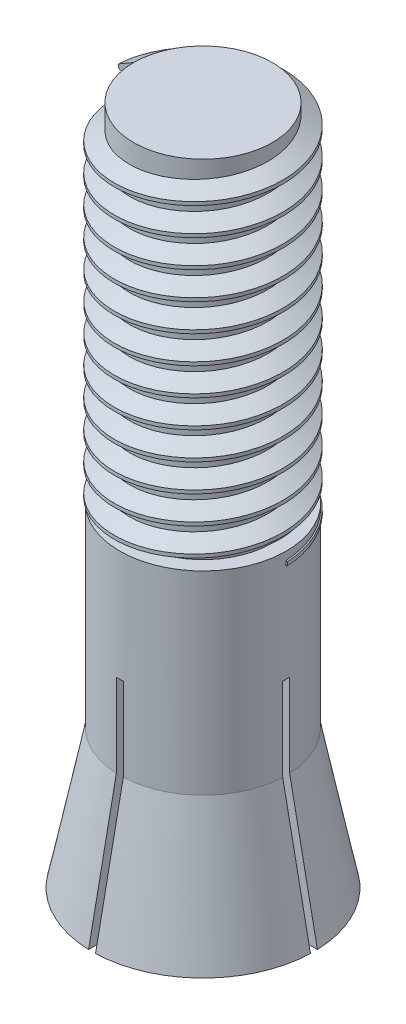
from build123d import *

# Parameters (mm, degrees)
SKETCH1_R           = 4
SKETCH2_R           = 3
SKETCH3_R           = 3
BOSS_EXTRUDE1_DEPTH = 7
SKETCH4_R           = 2.5
BOSS_EXTRUDE2_DEPTH = 12.5
SKETCH5_W           = 0.25
SKETCH5_H           = 16
CUT_EXTRUDE1_DEPTH  = 12.5
CIRPATTERN1_COUNT   = 4
THREAD1_PITCH       = 1
SKETCH9_R           = 1.55
CUT_EXTRUDE2_DEPTH  = 14.5


with BuildPart() as part:
    # Sketch1 → Loft1 section 0
    with BuildSketch(Plane(origin=(0, 0, 0), x_dir=(1, 0, 0), z_dir=(0, 1, 0))):
        Circle(SKETCH1_R)
    # Sketch2 → Loft1 section 1
    with BuildSketch(Plane(origin=(0, 5, 0), x_dir=(1, 0, 0), z_dir=(0, 1, 0))):
        Circle(SKETCH2_R)
    loft()

    # Sketch3 → Boss-Extrude1 (add)
    with BuildSketch(Plane(origin=(0, 5, 0), x_dir=(1, 0, 0), z_dir=(0, 1, 0))):
        with Locations(Location((0, 0, 0), (0, 0, 270))):
            Circle(SKETCH3_R)
    extrude(amount=BOSS_EXTRUDE1_DEPTH)

    # Sketch4 → Boss-Extrude2 (add)
    with BuildSketch(Plane(origin=(0, 12, 0), x_dir=(1, 0, 0), z_dir=(0, 1, 0))):
        with Locations(Location((0, 0, 0), (0, 0, 270))):
            Circle(SKETCH4_R)
    extrude(amount=BOSS_EXTRUDE2_DEPTH)

    # Sketch5 → Cut-Extrude1 (cut)
    with BuildSketch(Plane(origin=(0, 0, 0), x_dir=(0, 0, -1), z_dir=(1, 0, 0))):
        Rectangle(SKETCH5_W, SKETCH5_H)
    cut_extrude1 = extrude(amount=-CUT_EXTRUDE1_DEPTH, mode=Mode.SUBTRACT)

    # CirPattern1: Cut-Extrude1 ×4 about axis
    cirpattern1_axis = Axis((0, 0, 0), (0, 1, 0))
    for i in range(1, CIRPATTERN1_COUNT):
        add(cut_extrude1.rotate(cirpattern1_axis, i * 360 / CIRPATTERN1_COUNT), mode=Mode.SUBTRACT)

    # Thread1: the profile of Thread Profile1 profile screwed along a right-hand helix of 12.5 turns, 8 arcs to a turn; built about Z, then put on its axis
    thread1_z = Axis((0, 0, 0), (0, 0, 1))
    thread1_corners = [(2.4997, 0, -0.000173205), (3.041265875, 0, 0.312499999), (3.041265875, 0, 0.437499999), (2.4997, 0, 0.750173202)]
    with BuildLine(mode=Mode.PRIVATE) as thread1_profile:
        Line(thread1_corners[0], thread1_corners[1])
        Line(thread1_corners[1], thread1_corners[2])
        Line(thread1_corners[2], thread1_corners[3])
        Line(thread1_corners[3], thread1_corners[0])
    thread1_cap = Face(thread1_profile.wire())
    thread1_turn_angles = [0, 22.5, 45, 67.5, 90, 112.5, 135, 157.5, 180, 202.5, 225, 247.5, 270, 292.5, 315, 337.5, 360]
    thread1_turn_weights = [1, 0.9238795325112867, 1, 0.9238795325112867, 1, 0.9238795325112867, 1, 0.9238795325112867, 1, 0.9238795325112867, 1, 0.9238795325112867, 1, 0.9238795325112867, 1, 0.9238795325112867, 1]
    thread1_turn_rails = [Edge.make_bspline([Vector(p[0], p[1], 0).rotate(thread1_z, thread1_turn_angles[k]) / thread1_turn_weights[k] + Vector(0, 0, p[2] + THREAD1_PITCH * thread1_turn_angles[k] / 360) for k in range(17)], [0, 0, 0, 1, 1, 2, 2, 3, 3, 4, 4, 5, 5, 6, 6, 7, 7, 8, 8, 8], 2, thread1_turn_weights) for p in thread1_corners]
    thread1_turn_sides = [Face.make_surface_from_curves(thread1_turn_rails[p[0]], thread1_turn_rails[p[1]]) for p in [(0, 1), (1, 2), (2, 3), (3, 0)]]
    thread1_last_angles = [4320, 4342.5, 4365, 4387.5, 4410, 4432.5, 4455, 4477.5, 4500]
    thread1_last_weights = [1, 0.9238795325112867, 1, 0.9238795325112867, 1, 0.9238795325112867, 1, 0.9238795325112867, 1]
    thread1_last_rails = [Edge.make_bspline([Vector(p[0], p[1], 0).rotate(thread1_z, thread1_last_angles[k]) / thread1_last_weights[k] + Vector(0, 0, p[2] + THREAD1_PITCH * thread1_last_angles[k] / 360) for k in range(9)], [0, 0, 0, 1, 1, 2, 2, 3, 3, 4, 4, 4], 2, thread1_last_weights) for p in thread1_corners]
    thread1_last_sides = [Face.make_surface_from_curves(thread1_last_rails[p[0]], thread1_last_rails[p[1]]) for p in [(0, 1), (1, 2), (2, 3), (3, 0)]]
    thread1 = Plane(origin=(0, 24.5, 0), x_dir=(-1, 0, 0), z_dir=(0, -1, 0)) * Solid(Shell([*[p.moved(Location((0, 0, THREAD1_PITCH * i))) for i in range(12) for p in thread1_turn_sides], *thread1_last_sides, thread1_cap, thread1_cap.rotate(thread1_z, 4500).moved(Location((0, 0, THREAD1_PITCH * 4500 / 360)))]))
    add(thread1)

    # Sketch9 → Cut-Extrude2 (cut)
    with BuildSketch(Plane.XZ):
        with Locations(Location((0, 0, 0), (0, 0, 270))):
            Circle(SKETCH9_R)
    extrude(amount=-CUT_EXTRUDE2_DEPTH, mode=Mode.SUBTRACT)


solid = part.part
